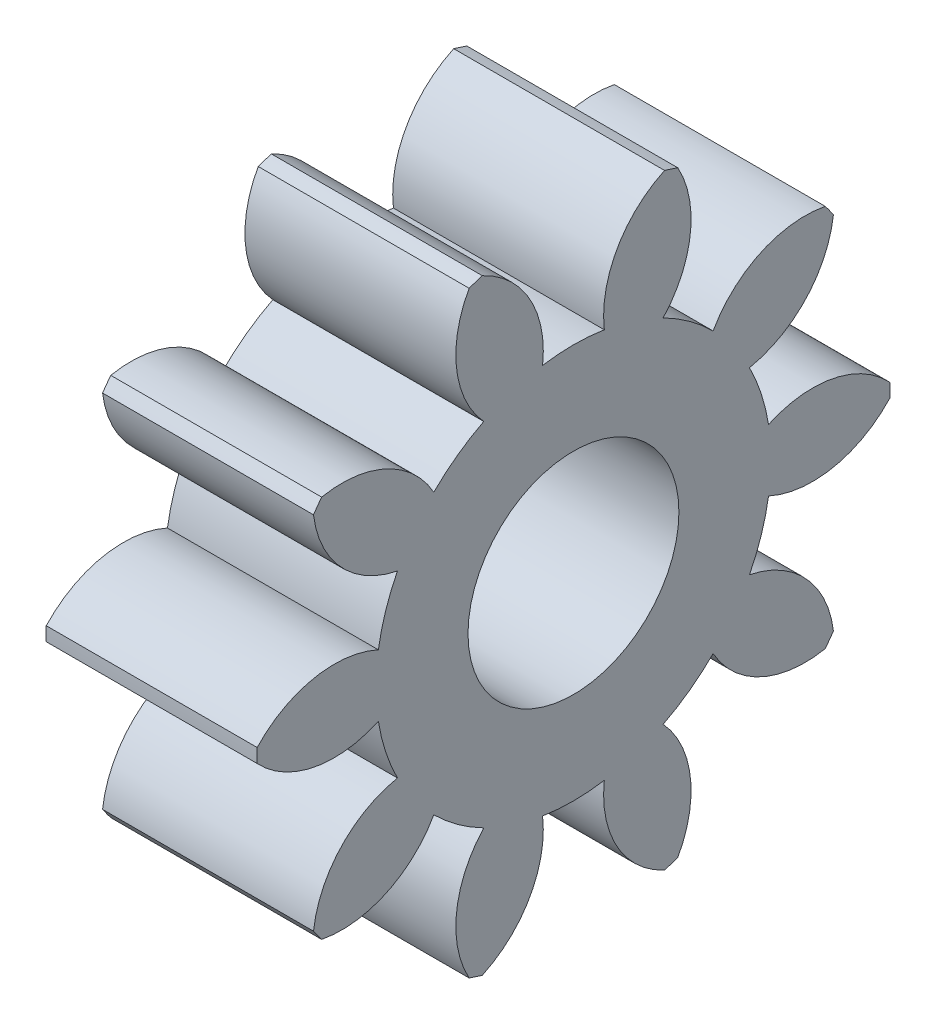
from build123d import *

# Parameters (mm, degrees)
BASPROSKE_W     = 1
BASPROSKE_H     = 1.5
TOOTHCUT_DEPTH  = 3.34520788
TEETHCUTS_COUNT = 10
TEETHCUTS_ANGLE = 324
BORSKE_R        = 0.5
BORE_DEPTH      = 50.0000508


with BuildPart() as part:
    # BasProSke → Base-Revolve (revolve)
    with BuildSketch(Plane(origin=(0, 0, 0), x_dir=(1, 0, 0), z_dir=(0, 1, 0))):
        with Locations((0.5, 0.75)):
            Rectangle(BASPROSKE_W, BASPROSKE_H)
    revolve(axis=Axis((-10, 0, 0), (1, 0, 0)))

    # TooCutSke → ToothCut (cut, through all)
    with BuildSketch(Plane(origin=(0, 0, 0), x_dir=(0, 0, -1), z_dir=(1, 0, 0))):
        with BuildLine():
            ThreePointArc((0.146321185, 0.924998573), (0, 0.9365), (-0.146321185, 0.924998573))
            ThreePointArc((-0.146321185, 0.924998573), (-0.216454601, 1.244005636), (-0.468585949, 1.451644712))
            ThreePointArc((-0.468585949, 1.451644712), (0, 1.5254), (0.468585949, 1.451644712))
            ThreePointArc((0.468585949, 1.451644712), (0.216454601, 1.244005636), (0.146321185, 0.924998573))
        make_face()
    toothcut = extrude(amount=TOOTHCUT_DEPTH, mode=Mode.SUBTRACT)

    # TeethCuts: ToothCut ×10 about axis
    teethcuts_axis = Axis((-10, 0, 0), (1, 0, 0))
    for i in range(1, TEETHCUTS_COUNT):
        add(toothcut.rotate(teethcuts_axis, i * TEETHCUTS_ANGLE / (TEETHCUTS_COUNT - 1)), mode=Mode.SUBTRACT)

    # BorSke → Bore (cut, symmetric)
    with BuildSketch(Plane(origin=(0, 0, 0), x_dir=(0, 0, -1), z_dir=(1, 0, 0))):
        Circle(BORSKE_R)
    extrude(amount=BORE_DEPTH, both=True, mode=Mode.SUBTRACT)


solid = part.part
